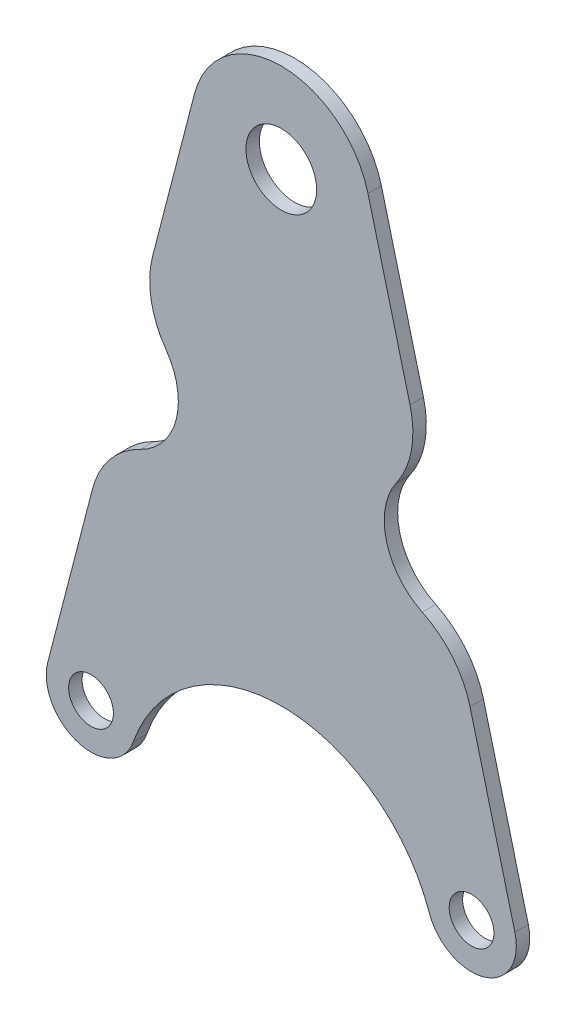
from build123d import *

# Parameters (mm, degrees)
SKETCH_1_R          = 7.9
SKETCH_1_R_2        = 5
EXTRUDE_1_DEPTH     = 3
SKETCH_3_R          = 15
CUT_EXTRUDE_2_DEPTH = 144.948775611
FILLET_1_R          = 20


with BuildPart() as part:
    # Эскиз1 → Бобышка-Вытянуть1 (new body)
    with BuildSketch(Plane.XY):
        with BuildLine():
            Line((-19.359148134, 5.022288675), (-52.179574067, -121.488855663))
            ThreePointArc((-52.179574067, -121.488855663), (-45.401310581, -133.569869221), (-33.055555556, -127.286710991))
            ThreePointArc((-33.055555556, -127.286710991), (0, -103.790199458), (33.055555556, -127.286710991))
            ThreePointArc((33.055555556, -127.286710991), (45.401310581, -133.569869221), (52.179574067, -121.488855663))
            Line((52.179574067, -121.488855663), (19.359148134, 5.022288675))
            ThreePointArc((19.359148134, 5.022288675), (0, 20), (-19.359148134, 5.022288675))
        make_face()
        Circle(SKETCH_1_R, mode=Mode.SUBTRACT)
        with Locations((-42.5, -124)):
            Circle(SKETCH_1_R_2, mode=Mode.SUBTRACT)
        with Locations((42.5, -124)):
            Circle(SKETCH_1_R_2, mode=Mode.SUBTRACT)
    extrude(amount=EXTRUDE_1_DEPTH)

    # Эскиз3 → Вырез-Вытянуть2 (cut, through all)
    with BuildSketch(Plane.XY.offset(3)):
        with Locations((-38, -56.391488719)):
            Circle(SKETCH_3_R)
        with Locations((38, -56.391488719)):
            Circle(SKETCH_3_R)
    extrude(amount=-CUT_EXTRUDE_2_DEPTH, mode=Mode.SUBTRACT)

    # Скругление1
    fillet_1_edges = [part.edges().sort_by_distance(p)[0] for p in [
        (39.171079178, -71.345704632, 1.5),
        (31.7536013, -42.753948498, 1.5),
        (-39.171079178, -71.345704632, 1.5),
        (-31.7536013, -42.753948498, 1.5),
    ]]
    fillet(fillet_1_edges, radius=FILLET_1_R)


solid = part.part
